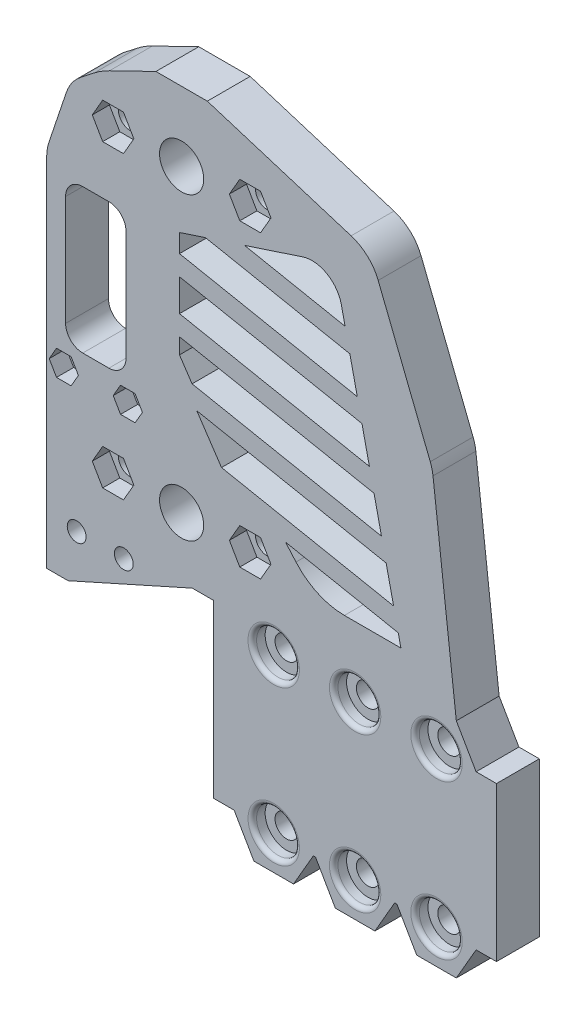
from build123d import *

# Parameters (mm, degrees)
SKETCH_1_W                 = 211.039105054
SKETCH_1_H                 = 148.201618718
EXTRUDE_1_DEPTH            = 10
CUT_EXTRUDE_1_DEPTH        = 130.326354287
CUT_EXTRUDE_2_DEPTH        = 130.326354287
SKETCH_6_R                 = 2.5
CUT_EXTRUDE_3_DEPTH        = 130.326354287
SKETCH_7_R                 = 2.5
CUT_EXTRUDE_4_DEPTH        = 130.326354287
SKETCH_8_R                 = 2.75
CUT_EXTRUDE_5_DEPTH        = 130.326354287
SKETCH_9_R                 = 2.75
CUT_EXTRUDE_6_DEPTH        = 130.326354287
SKETCH_10_R                = 2.75
CUT_EXTRUDE_7_DEPTH        = 130.326354287
SKETCH_11_R                = 2.75
EXTRUDE_3_DEPTH            = 10
SKETCH_12_W                = 106.039105054
SKETCH_12_H                = 148.201618718
CUT_EXTRUDE_8_DEPTH        = 130.326354287
CUT_EXTRUDE_9_DEPTH        = 130.326354287
CUT_EXTRUDE_11_DEPTH       = 130.326354287
CUT_EXTRUDE_12_DEPTH       = 10
CUT_EXTRUDE_13_DEPTH       = 10
FILLET_1_R                 = 10
FILLET_2_R                 = 10
FILLET_3_R                 = 10
FILLET_4_R                 = 10
SKETCH_19_W                = 14.096766614
SKETCH_19_H                = 41.379173134
CUT_EXTRUDE_15_DEPTH       = 130.326354287
FILLET_6_R                 = 4
EXTRUDE_4_DEPTH            = 10
FILLET_7_R                 = 4
SKETCH_21_R                = 2
CUT_EXTRUDE_16_DEPTH       = 2
FILLET_8_R                 = 1
SKETCH_22_R                = 1.5
CUT_EXTRUDE_17_DEPTH       = 130.326354287
CUT_EXTRUDE_18_DEPTH       = 130.326354287
EXTRUDE_5_DEPTH            = 10
CUT_EXTRUDE_19_DEPTH       = 130.326354287
FILLET_9_R                 = 15
CHAMFER_2_SIZE             = 10
CHAMFER_2_SIZE_2           = 12.687576361
CHAMFER_3_SIZE             = 3
CHAMFER_3_SIZE2            = 3.806272908
CUT_EXTRUDE_20_DEPTH       = 4
EXTRUDE_6_DEPTH            = 10
FILLET_10_DEPTH            = 10
FILLET_11_DEPTH            = 10
SKETCH_28_R                = 4.5
CUT_EXTRUDE_21_DEPTH       = 3
FILLET_12_R                = 1
SKETCH_29_R                = 2
CUT_EXTRUDE_22_DEPTH       = 130.326354287
CUT_EXTRUDE_23_DEPTH       = 3.3
SKETCH_31_R                = 5.15
SKETCH_31_R_2              = 2.7
SKETCH_31_R_3              = 2.2
SKETCH_31_R_4              = 1.7
CUT_EXTRUDE_24_DEPTH       = 130.326354287
SKETCH_32_R                = 2.5
CUT_EXTRUDE_25_DEPTH       = 2
FILLET_13_R                = 1
CUT_EXTRUDE_26_DEPTH       = 3.3
CUT_EXTRUDE_27_DEPTH       = 4
CUT_EXTRUDE_START          = -3
CUT_EXTRUDE_28_OUTLINE_R   = 5
CUT_EXTRUDE_28_OUTLINE_R_2 = 2.7
CUT_EXTRUDE_28_DEPTH       = 3
FILLET_14_R                = 1
FILLET_15_R                = 1
FILLET_16_R                = 1
FILLET_17_R                = 1
FILLET_18_R                = 1
FILLET_19_R                = 1


with BuildPart() as part:
    # Эскиз1 → Бобышка-Вытянуть1 (new body)
    with BuildSketch(Plane.XY):
        Rectangle(SKETCH_1_W, SKETCH_1_H)
    extrude(amount=EXTRUDE_1_DEPTH)

    # Эскиз2 → Вырез-Вытянуть1 (cut, through all)
    with BuildSketch(Plane.XY.offset(10)):
        Polygon((39.519552527, -74.100809359), (48.899552527, -74.100809359), (44.279552527, -66.100809359), (39.519552527, -66.100809359), align=None)
        Polygon((58.139552527, -74.100809359), (67.899552527, -74.100809359), (63.279552527, -66.100809359), (62.759552527, -66.100809359), align=None)
        Polygon((77.139552527, -74.100809359), (86.899552527, -74.100809359), (82.279552527, -66.100809359), (81.759552527, -66.100809359), align=None)
        Polygon((96.139552527, -74.100809359), (105.519552527, -74.100809359), (105.519552527, -66.100809359), (100.759552527, -66.100809359), align=None)
    extrude(amount=-CUT_EXTRUDE_1_DEPTH, mode=Mode.SUBTRACT)

    # Эскиз3 → Вырез-Вытянуть2 (cut, through all)
    with BuildSketch(Plane.XY.offset(10)):
        Polygon((100.759552527, -30.100809359), (105.519552527, -30.100809359), (105.519552527, 74.100809359), (96.139552527, 74.100809359), (96.139552527, -22.100809359), align=None)
    extrude(amount=-CUT_EXTRUDE_2_DEPTH, mode=Mode.SUBTRACT)

    # Эскиз6 → Вырез-Вытянуть3 (cut, through all)
    with BuildSketch(Plane.XY.offset(10)):
        with Locations((72.519552527, -66.100809359)):
            Circle(SKETCH_6_R)
        with Locations((53.519552527, -66.100809359)):
            Circle(SKETCH_6_R)
        with Locations((91.519552527, -66.100809359)):
            Circle(SKETCH_6_R)
    extrude(amount=-CUT_EXTRUDE_3_DEPTH, mode=Mode.SUBTRACT)

    # Эскиз7 → Вырез-Вытянуть4 (cut, through all)
    with BuildSketch(Plane.XY.offset(10)):
        with Locations((53.519552527, -66.100809359)):
            Circle(SKETCH_7_R)
        with Locations((72.519552527, -66.100809359)):
            Circle(SKETCH_7_R)
        with Locations((91.519552527, -66.100809359)):
            Circle(SKETCH_7_R)
        with Locations(Location((91.519552527, -30.100809359, 0), (0, 0, 180))):
            Circle(SKETCH_7_R)
        with Locations(Location((72.519552527, -30.100809359, 0), (0, 0, 180))):
            Circle(SKETCH_7_R)
        with Locations(Location((53.519552527, -30.100809359, 0), (0, 0, 180))):
            Circle(SKETCH_7_R)
    extrude(amount=-CUT_EXTRUDE_4_DEPTH, mode=Mode.SUBTRACT)

    # Эскиз8 → Вырез-Вытянуть5 (cut, through all)
    with BuildSketch(Plane(origin=(0, 0, 0), x_dir=(-1, 0, 0), z_dir=(0, 0, -1))):
        with Locations((-48.019552527, -12.100809359)):
            Circle(SKETCH_8_R)
        with Locations((-16.019552527, -12.100809359)):
            Circle(SKETCH_8_R)
    extrude(amount=-CUT_EXTRUDE_5_DEPTH, mode=Mode.SUBTRACT)

    # Эскиз9 → Вырез-Вытянуть6 (cut, through all)
    with BuildSketch(Plane(origin=(0, 0, 0), x_dir=(-1, 0, 0), z_dir=(0, 0, -1))):
        with Locations((-48.019552527, 63.899190641)):
            Circle(SKETCH_9_R)
        with Locations((-16.019552527, 63.899190641)):
            Circle(SKETCH_9_R)
    extrude(amount=-CUT_EXTRUDE_6_DEPTH, mode=Mode.SUBTRACT)

    # Эскиз10 → Вырез-Вытянуть7 (cut, through all)
    with BuildSketch(Plane(origin=(0, 0, 0), x_dir=(-1, 0, 0), z_dir=(0, 0, -1))):
        with Locations((-48.019552527, 57.899190641)):
            Circle(SKETCH_10_R)
        with Locations((-16.019552527, 57.899190641)):
            Circle(SKETCH_10_R)
    extrude(amount=-CUT_EXTRUDE_7_DEPTH, mode=Mode.SUBTRACT)

    # Эскиз11 → Бобышка-Вытянуть3 (add)
    with BuildSketch(Plane(origin=(0, 0, 0), x_dir=(-1, 0, 0), z_dir=(0, 0, -1))):
        with Locations((-48.019552527, 63.899190641)):
            Circle(SKETCH_11_R)
        with Locations((-16.019552527, 63.899190641)):
            Circle(SKETCH_11_R)
    extrude(amount=-EXTRUDE_3_DEPTH)

    # Эскиз12 → Вырез-Вытянуть8 (cut, through all)
    with BuildSketch(Plane(origin=(0, 0, 0), x_dir=(-1, 0, 0), z_dir=(0, 0, -1))):
        with Locations((52.5, 0)):
            Rectangle(SKETCH_12_W, SKETCH_12_H)
    extrude(amount=-CUT_EXTRUDE_8_DEPTH, mode=Mode.SUBTRACT)

    # Эскиз13 → Вырез-Вытянуть9 (cut, through all)
    with BuildSketch(Plane(origin=(0, 0, 0), x_dir=(-1, 0, 0), z_dir=(0, 0, -1))):
        Polygon((-39.519552527, -26.100809359), (-39.519552527, -30.100809359), (-39.519552527, -39.100809359), (-39.519552527, -66.100809359), (-39.519552527, -74.100809359), (-0.519552527, -74.100809359), (-0.519552527, -39.100809359), (-5.519552527, -39.100809359), (-34.519552527, -26.100809359), align=None)
    extrude(amount=-CUT_EXTRUDE_9_DEPTH, mode=Mode.SUBTRACT)

    # Эскиз14 → Вырез-Вытянуть11 (cut, through all)
    with BuildSketch(Plane(origin=(0, 0, 0), x_dir=(-1, 0, 0), z_dir=(0, 0, -1))):
        with BuildLine():
            Line((-26.019552527, 74.100809359), (-0.519552527, 74.100809359))
            Line((-0.519552527, 74.100809359), (-0.519552527, 57.899190641))
            Line((-0.519552527, 57.899190641), (-0.519552527, 45.742327896))
            Line((-0.519552527, 45.742327896), (-6.055786387, 62.241334845))
            Line((-6.055786387, 62.241334845), (-11.592020247, 66.583479049))
            ThreePointArc((-11.592020247, 66.583479049), (-13.329635828, 67.80312297), (-15.186741047, 68.831713952))
            Line((-15.186741047, 68.831713952), (-26.019552527, 74.100809359))
        make_face()
    extrude(amount=-CUT_EXTRUDE_11_DEPTH, mode=Mode.SUBTRACT)

    # Эскиз17 → Вырез-Вытянуть12 (cut)
    with BuildSketch(Plane(origin=(0, 0, 0), x_dir=(-1, 0, 0), z_dir=(0, 0, -1))):
        Polygon((-38.019552527, 74.100809359), (-76.139552527, 62.241334845), (-90.54927331, 26), (-96.139552527, -22.100809359), (-96.139552527, 74.100809359), align=None)
    extrude(amount=-CUT_EXTRUDE_12_DEPTH, mode=Mode.SUBTRACT)

    # Эскиз18 → Вырез-Вытянуть13 (cut)
    with BuildSketch(Plane(origin=(0, 0, 0), x_dir=(-1, 0, 0), z_dir=(0, 0, -1))):
        with BuildLine():
            ThreePointArc((-27.019552527, 57.899190641), (-32.019552527, 62.899190641), (-37.019552527, 57.899190641))
            Line((-37.019552527, 57.899190641), (-27.019552527, 57.899190641))
        make_face()
        with BuildLine():
            Line((-27.019552527, 57.899190641), (-37.019552527, 57.899190641))
            ThreePointArc((-37.019552527, 57.899190641), (-32.019552527, 52.899190641), (-27.019552527, 57.899190641))
        make_face()
        with BuildLine():
            ThreePointArc((-27.019552527, -12.100809359), (-32.019552527, -7.100809359), (-37.019552527, -12.100809359))
            Line((-37.019552527, -12.100809359), (-27.019552527, -12.100809359))
        make_face()
        with BuildLine():
            Line((-27.019552527, -12.100809359), (-37.019552527, -12.100809359))
            ThreePointArc((-37.019552527, -12.100809359), (-32.019552527, -17.100809359), (-27.019552527, -12.100809359))
        make_face()
    extrude(amount=-CUT_EXTRUDE_13_DEPTH, mode=Mode.SUBTRACT)

    # Скругление1
    fillet_1_edges = [part.edges().sort_by_distance(p)[0] for p in [
        (76.139552527, 62.241334845, 5),
    ]]
    fillet(fillet_1_edges, radius=FILLET_1_R)

    # Скругление2
    fillet_2_edges = [part.edges().sort_by_distance(p)[0] for p in [
        (90.54927331, 26, 5),
    ]]
    fillet(fillet_2_edges, radius=FILLET_2_R)

    # Скругление3
    fillet_3_edges = [part.edges().sort_by_distance(p)[0] for p in [
        (6.055786387, 62.241334845, 5),
    ]]
    fillet(fillet_3_edges, radius=FILLET_3_R)

    # Скругление4
    fillet_4_edges = [part.edges().sort_by_distance(p)[0] for p in [
        (0.519552527, 45.742327896, 5),
    ]]
    fillet(fillet_4_edges, radius=FILLET_4_R)

    # Эскиз19 → Вырез-Вытянуть15 (cut, through all)
    with BuildSketch(Plane(origin=(0, 0, 0), x_dir=(-1, 0, 0), z_dir=(0, 0, -1))):
        with Locations((-11.990658259, 26.60091532)):
            Rectangle(SKETCH_19_W, SKETCH_19_H)
    extrude(amount=-CUT_EXTRUDE_15_DEPTH, mode=Mode.SUBTRACT)

    # Скругление6
    fillet_6_edges = [part.edges().sort_by_distance(p)[0] for p in [
        (4.942274952, 5.911328753, 5),
        (19.039041566, 5.911328753, 5),
        (19.039041566, 47.290501887, 5),
        (4.942274952, 47.290501887, 5),
    ]]
    fillet(fillet_6_edges, radius=FILLET_6_R)

    # Эскиз20 → Бобышка-Вытянуть4 (add)
    with BuildSketch(Plane(origin=(0, 0, 0), x_dir=(-1, 0, 0), z_dir=(0, 0, -1))):
        Polygon((-19.039041566, 47.290501887), (-19.039041566, 43.290501887), (-19.039041566, 42.290501887), (-4.942274952, 42.290501887), (-4.942274952, 47.290501887), align=None)
    extrude(amount=-EXTRUDE_4_DEPTH)

    # Скругление7
    fillet_7_edges = [part.edges().sort_by_distance(p)[0] for p in [
        (19.039041566, 42.290501887, 5),
        (4.942274952, 42.290501887, 5),
    ]]
    fillet(fillet_7_edges, radius=FILLET_7_R)

    # Эскиз21 → Вырез-Вытянуть16 (cut)
    with BuildSketch(Plane(origin=(0, 0, 0), x_dir=(-1, 0, 0), z_dir=(0, 0, -1))):
        with Locations((-11.990658259, 46.790501887)):
            Circle(SKETCH_21_R)
    extrude(amount=-CUT_EXTRUDE_16_DEPTH, mode=Mode.SUBTRACT)

    # Скругление8
    fillet_8_edges = [part.edges().sort_by_distance(p)[0] for p in [
        (13.990658259, 46.790501887, 0),
    ]]
    fillet(fillet_8_edges, radius=FILLET_8_R)

    # Эскиз22 → Вырез-Вытянуть17 (cut, through all)
    with BuildSketch(Plane(origin=(0, 0, 0), x_dir=(-1, 0, 0), z_dir=(0, 0, -1))):
        with Locations((-4.519552527, 3.601328753)):
            Circle(SKETCH_22_R)
        with Locations((-19.459552527, 3.601328753)):
            Circle(SKETCH_22_R)
    extrude(amount=-CUT_EXTRUDE_17_DEPTH, mode=Mode.SUBTRACT)

    # Эскиз23 → Вырез-Вытянуть18 (cut, through all)
    with BuildSketch(Plane(origin=(0, 0, 0), x_dir=(-1, 0, 0), z_dir=(0, 0, -1))):
        with BuildLine():
            Line((-83.202253585, -13.858982793), (-69.299601314, 48.615184052))
            ThreePointArc((-69.299601314, 48.615184052), (-65.927986564, 53.179027934), (-60.282091208, 53.744998448))
            Line((-60.282091208, 53.744998448), (-31.519552527, 44.296464045))
            Line((-31.519552527, 44.296464045), (-31.519552527, 4.027188786))
            Line((-31.519552527, 4.027188786), (-33.250013878, 4.027188786))
            Line((-33.250013878, 4.027188786), (-50.568370486, 0.620298961))
            Line((-50.568370486, 0.620298961), (-63.202253585, -13.858982793))
            Line((-63.202253585, -13.858982793), (-83.202253585, -13.858982793))
        make_face()
    extrude(amount=-CUT_EXTRUDE_18_DEPTH, mode=Mode.SUBTRACT)

    # Эскиз24 → Бобышка-Вытянуть5 (add)
    with BuildSketch(Plane(origin=(0, 0, 0), x_dir=(-1, 0, 0), z_dir=(0, 0, -1))):
        Polygon((-46.699474212, 49.283089665), (-70.178831302, 44.664199746), (-71.291503385, 39.664199746), (-37.596452717, 46.292734303), align=None)
        Polygon((-31.519552527, 40.021065968), (-73.029270164, 31.855219875), (-74.115374402, 26.974607456), (-31.519552527, 35.354113399), align=None)
        Polygon((-31.519552527, 27.886989288), (-75.853141181, 19.165627585), (-76.939245419, 14.285015166), (-31.519552527, 23.220036719), align=None)
        Polygon((-31.519552527, 15.752912608), (-78.677012198, 6.476035296), (-79.763116436, 1.595422877), (-31.519552527, 11.085960039), align=None)
        Polygon((-51.357093882, -0.283631223), (-81.500883215, -6.213556994), (-82.586987453, -11.094169413), (-56.273059249, -5.917658947), align=None)
    extrude(amount=-EXTRUDE_5_DEPTH)

    # Эскиз25 → Вырез-Вытянуть19 (cut, through all)
    with BuildSketch(Plane(origin=(0, 0, 0), x_dir=(-1, 0, 0), z_dir=(0, 0, -1))):
        Polygon((-52.445727222, 6.969335509), (-51.357093882, -0.283631223), (-31.519552527, 3.618835928), (-31.519552527, 4.027188786), (-31.519552527, 11.085960039), align=None)
    extrude(amount=-CUT_EXTRUDE_19_DEPTH, mode=Mode.SUBTRACT)

    # Скругление9
    fillet_9_edges = [part.edges().sort_by_distance(p)[0] for p in [
        (63.202253585, -13.858982793, 5),
    ]]
    fillet(fillet_9_edges, radius=FILLET_9_R)

    # Фаска2
    # the kernel refuses this chamfer: 12.687576361, 10 mm, written as the material it adds along each edge
    with BuildSketch(Plane(origin=(31.519552527, 3.618835928, 0), x_dir=(0.9811944564911176, -0.19302186029333682, 0), z_dir=(0, 0, 1))) as chamfer_2_piece_1_section:
        Polygon((CHAMFER_2_SIZE, 0), (-CHAMFER_2_SIZE_2 * 0.193021860295, CHAMFER_2_SIZE_2 * 0.9811944565), (0, 0), align=None)
    chamfer_2_piece_1 = extrude(amount=10, mode=Mode.PRIVATE)
    chamfer_2_piece_1 = split(chamfer_2_piece_1, bisect_by=Plane(origin=(33.817649326, 15.300827992, 0), z_dir=(-0.19302186029333676, -0.9811944564911176, 0)), keep=Keep.TOP, mode=Mode.PRIVATE)
    add(chamfer_2_piece_1)

    # Фаска3
    chamfer_3_edges = [part.edges().sort_by_distance(p)[0] for p in [
        (31.519552527, 15.752912608, 5),
    ]]
    chamfer_3_side = [part.faces().sort_by_distance(p)[0] for p in [
        (55.098282363, 11.114473952, 5),
    ]]
    chamfer(chamfer_3_edges, length=CHAMFER_3_SIZE, length2=CHAMFER_3_SIZE2, reference=chamfer_3_side[0])

    # Эскиз26 → Вырез-Вытянуть20 (cut)
    with BuildSketch(Plane.XY.offset(10)):
        Polygon((18.328953604, 53.899190641), (20.63835468, 57.899190641), (18.328953604, 61.899190641), (13.71015145, 61.899190641), (11.400750373, 57.899190641), (13.71015145, 53.899190641), align=None)
        Polygon((43.400750373, 57.899190641), (45.71015145, 53.899190641), (50.328953604, 53.899190641), (52.63835468, 57.899190641), (50.328953604, 61.899190641), (45.71015145, 61.899190641), align=None)
        Polygon((20.63835468, -12.100809359), (18.328953604, -8.100809359), (13.71015145, -8.100809359), (11.400750373, -12.100809359), (13.71015145, -16.100809359), (18.328953604, -16.100809359), align=None)
        Polygon((52.63835468, -12.100809359), (50.328953604, -8.100809359), (45.71015145, -8.100809359), (43.400750373, -12.100809359), (45.71015145, -16.100809359), (50.328953604, -16.100809359), align=None)
        Polygon((6.107265767, 0.851328753), (7.694979007, 3.601328753), (6.107265767, 6.351328753), (2.931839287, 6.351328753), (1.344126046, 3.601328753), (2.931839287, 0.851328753), align=None)
        Polygon((21.047265767, 0.851328753), (22.634979007, 3.601328753), (21.047265767, 6.351328753), (17.871839287, 6.351328753), (16.284126046, 3.601328753), (17.871839287, 0.851328753), align=None)
    extrude(amount=-CUT_EXTRUDE_20_DEPTH, mode=Mode.SUBTRACT)

    # Эскиз27 → Бобышка-Вытянуть6 (add)
    with BuildSketch(Plane.XY.offset(10)):
        Polygon((18.83108489, 8.638376504), (5.150231629, 8.638376504), (5.777883842, 6.768640711), (8.050442888, 5.638376504), (15.868553058, 5.638376504), (18.83108489, 7.138376504), align=None)
    extrude(amount=-EXTRUDE_6_DEPTH)

    # Скругление10: read off the stored shape, not the designer's step
    # Скругление10 outline → Скругление10 (add)
    with BuildSketch(Plane.XY):
        with BuildLine():
            ThreePointArc((8.942274952, 8.638376504), (6.113847827, 9.80994938), (4.942274952, 12.638376504))
            Line((4.942274952, 12.638376504), (4.942274952, 9.911328753))
            ThreePointArc((4.942274952, 9.911328753), (4.994606445, 9.266415308), (5.150231629, 8.638376504))
            Line((5.150231629, 8.638376504), (8.942274952, 8.638376504))
        make_face()
    extrude(amount=FILLET_10_DEPTH)

    # Скругление11: read off the stored shape, not the designer's step
    # Скругление11 outline → Скругление11 (add)
    with BuildSketch(Plane.XY):
        with BuildLine():
            Line((19.039041566, 9.911328753), (19.039041566, 12.638376504))
            ThreePointArc((19.039041566, 12.638376504), (17.867468691, 9.809949379), (15.039041566, 8.638376504))
            Line((15.039041566, 8.638376504), (18.83108489, 8.638376504))
            ThreePointArc((18.83108489, 8.638376504), (18.986710074, 9.266415308), (19.039041566, 9.911328753))
        make_face()
    extrude(amount=FILLET_11_DEPTH)

    # Эскиз28 → Вырез-Вытянуть21 (cut)
    with BuildSketch(Plane.XY.offset(10)):
        with Locations((53.519552527, -30.100809359)):
            Circle(SKETCH_28_R)
        with Locations((72.519552527, -30.100809359)):
            Circle(SKETCH_28_R)
        with Locations((91.519552527, -30.100809359)):
            Circle(SKETCH_28_R)
        with Locations((91.519552527, -66.100809359)):
            Circle(SKETCH_28_R)
        with Locations((72.519552527, -66.100809359)):
            Circle(SKETCH_28_R)
        with Locations((53.519552527, -66.100809359)):
            Circle(SKETCH_28_R)
    extrude(amount=-CUT_EXTRUDE_21_DEPTH, mode=Mode.SUBTRACT)

    # Скругление12
    fillet_12_edges = [part.edges().sort_by_distance(p)[0] for p in [
        (49.019552527, -30.100809359, 10),
        (68.019552527, -30.100809359, 10),
        (87.019552527, -30.100809359, 10),
        (87.019552527, -66.100809359, 10),
        (68.019552527, -66.100809359, 10),
        (49.019552527, -66.100809359, 10),
    ]]
    fillet(fillet_12_edges, radius=FILLET_12_R)

    # Эскиз29 → Вырез-Вытянуть22 (cut, through all)
    with BuildSketch(Plane(origin=(0, 0, 0), x_dir=(-1, 0, 0), z_dir=(0, 0, -1))):
        with Locations((-7.519552527, -28.170809359)):
            Circle(SKETCH_29_R)
        with Locations((-18.519552527, -28.170809359)):
            Circle(SKETCH_29_R)
    extrude(amount=-CUT_EXTRUDE_22_DEPTH, mode=Mode.SUBTRACT)

    # Эскиз30 → Вырез-Вытянуть23 (cut)
    with BuildSketch(Plane(origin=(0, 0, 0), x_dir=(-1, 0, 0), z_dir=(0, 0, -1))):
        Polygon((-7.519552527, -32.212261243), (-4.019552527, -30.191535301), (-4.019552527, -26.150083417), (-7.519552527, -24.129357474), (-11.019552527, -26.150083417), (-11.019552527, -30.191535301), align=None)
        Polygon((-18.519552527, -32.212261243), (-15.019552527, -30.191535301), (-15.019552527, -26.150083417), (-18.519552527, -24.129357474), (-22.019552527, -26.150083417), (-22.019552527, -30.191535301), align=None)
    extrude(amount=-CUT_EXTRUDE_23_DEPTH, mode=Mode.SUBTRACT)

    # Эскиз31 → Вырез-Вытянуть24 (cut, through all)
    with BuildSketch(Plane(origin=(0, 0, 0), x_dir=(-1, 0, 0), z_dir=(0, 0, -1))):
        with Locations((-32.019552527, 57.899190641)):
            Circle(SKETCH_31_R)
        with Locations((-16.019552527, 57.899190641)):
            Circle(SKETCH_31_R_2)
        with Locations((-48.019552527, 57.899190641)):
            Circle(SKETCH_31_R_2)
        with Locations((-32.019552527, -12.100809359)):
            Circle(SKETCH_31_R)
        with Locations((-16.019552527, -12.100809359)):
            Circle(SKETCH_31_R_2)
        with Locations((-48.019552527, -12.100809359)):
            Circle(SKETCH_31_R_2)
        with Locations((-53.519552527, -30.100809359)):
            Circle(SKETCH_31_R_2)
        with Locations((-72.519552527, -30.100809359)):
            Circle(SKETCH_31_R_2)
        with Locations((-91.519552527, -30.100809359)):
            Circle(SKETCH_31_R_2)
        with Locations((-91.519552527, -66.100809359)):
            Circle(SKETCH_31_R_2)
        with Locations((-72.519552527, -66.100809359)):
            Circle(SKETCH_31_R_2)
        with Locations((-53.519552527, -66.100809359)):
            Circle(SKETCH_31_R_2)
        with Locations((-18.519552527, -28.170809359)):
            Circle(SKETCH_31_R_3)
        with Locations((-7.519552527, -28.170809359)):
            Circle(SKETCH_31_R_3)
        with Locations((-4.519552527, 3.601328753)):
            Circle(SKETCH_31_R_4)
        with Locations((-19.459552527, 3.601328753)):
            Circle(SKETCH_31_R_4)
    extrude(amount=-CUT_EXTRUDE_24_DEPTH, mode=Mode.SUBTRACT)

    # Эскиз32 → Вырез-Вытянуть25 (cut)
    with BuildSketch(Plane(origin=(0, 0, 0), x_dir=(-1, 0, 0), z_dir=(0, 0, -1))):
        with Locations((-11.990658259, 46.790501887)):
            Circle(SKETCH_32_R)
    extrude(amount=-CUT_EXTRUDE_25_DEPTH, mode=Mode.SUBTRACT)

    # Скругление13
    fillet_13_edges = [part.edges().sort_by_distance(p)[0] for p in [
        (14.990658259, 46.790501887, 0),
        (14.490658259, 46.790501887, 0.133974596),
    ]]
    fillet(fillet_13_edges, radius=FILLET_13_R - 0.0001)  # a hair under: the kernel refuses the full size

    # Эскиз33 → Вырез-Вытянуть26 (cut)
    with BuildSketch(Plane(origin=(0, 0, 0), x_dir=(-1, 0, 0), z_dir=(0, 0, -1))):
        Polygon((-18.519552527, -32.443201351), (-14.819552527, -30.307005355), (-14.819552527, -26.034613363), (-18.519552527, -23.898417367), (-22.219552527, -26.034613363), (-22.219552527, -30.307005355), align=None)
        Polygon((-7.519552527, -32.443201351), (-3.819552527, -30.307005355), (-3.819552527, -26.034613363), (-7.519552527, -23.898417367), (-11.219552527, -26.034613363), (-11.219552527, -30.307005355), align=None)
    extrude(amount=-CUT_EXTRUDE_26_DEPTH, mode=Mode.SUBTRACT)

    # Эскиз34 → Вырез-Вытянуть27 (cut)
    with BuildSketch(Plane.XY.offset(10)):
        Polygon((50.444423658, 53.699190641), (52.869294788, 57.899190641), (50.444423658, 62.099190641), (45.594681396, 62.099190641), (43.169810266, 57.899190641), (45.594681396, 53.699190641), align=None)
        Polygon((18.444423658, 53.699190641), (20.869294788, 57.899190641), (18.444423658, 62.099190641), (13.594681396, 62.099190641), (11.169810266, 57.899190641), (13.594681396, 53.699190641), align=None)
        Polygon((17.756369233, 0.651328753), (21.162735821, 0.651328753), (22.865919115, 3.601328753), (21.162735821, 6.551328753), (17.756369233, 6.551328753), (16.053185939, 3.601328753), align=None)
        Polygon((2.816369233, 0.651328753), (6.222735821, 0.651328753), (7.925919115, 3.601328753), (6.222735821, 6.551328753), (2.816369233, 6.551328753), (1.113185939, 3.601328753), align=None)
        Polygon((13.594681396, -16.300809359), (18.444423658, -16.300809359), (20.869294788, -12.100809359), (18.444423658, -7.900809359), (13.594681396, -7.900809359), (11.169810266, -12.100809359), align=None)
        Polygon((45.594681396, -16.300809359), (50.444423658, -16.300809359), (52.869294788, -12.100809359), (50.444423658, -7.900809359), (45.594681396, -7.900809359), (43.169810266, -12.100809359), align=None)
    extrude(amount=-CUT_EXTRUDE_27_DEPTH, mode=Mode.SUBTRACT)

    # Вырез-Вытянуть28: read off the stored shape, not the designer's step
    # Вырез-Вытянуть28 outline → Вырез-Вытянуть28 (cut)
    # profile 1 of 6: a face of its own
    with BuildSketch(Plane.XY.offset(10).offset(CUT_EXTRUDE_START)):
        with Locations((53.519552527, -30.100809359)):
            Circle(CUT_EXTRUDE_28_OUTLINE_R)
        with Locations((53.519552527, -30.100809359)):
            Circle(CUT_EXTRUDE_28_OUTLINE_R_2, mode=Mode.SUBTRACT)
    # profile 2 of 6: a face of its own
    with BuildSketch(Plane.XY.offset(10).offset(CUT_EXTRUDE_START)):
        with Locations((72.519552527, -30.100809359)):
            Circle(CUT_EXTRUDE_28_OUTLINE_R)
        with Locations((72.519552527, -30.100809359)):
            Circle(CUT_EXTRUDE_28_OUTLINE_R_2, mode=Mode.SUBTRACT)
    # profile 3 of 6: a face of its own
    with BuildSketch(Plane.XY.offset(10).offset(CUT_EXTRUDE_START)):
        with Locations((91.519552527, -30.100809359)):
            Circle(CUT_EXTRUDE_28_OUTLINE_R)
        with Locations((91.519552527, -30.100809359)):
            Circle(CUT_EXTRUDE_28_OUTLINE_R_2, mode=Mode.SUBTRACT)
    # profile 4 of 6: a face of its own
    with BuildSketch(Plane.XY.offset(10).offset(CUT_EXTRUDE_START)):
        with Locations((91.519552527, -66.100809359)):
            Circle(CUT_EXTRUDE_28_OUTLINE_R)
        with Locations((91.519552527, -66.100809359)):
            Circle(CUT_EXTRUDE_28_OUTLINE_R_2, mode=Mode.SUBTRACT)
    # profile 5 of 6: a face of its own
    with BuildSketch(Plane.XY.offset(10).offset(CUT_EXTRUDE_START)):
        with Locations((72.519552527, -66.100809359)):
            Circle(CUT_EXTRUDE_28_OUTLINE_R)
        with Locations((72.519552527, -66.100809359)):
            Circle(CUT_EXTRUDE_28_OUTLINE_R_2, mode=Mode.SUBTRACT)
    # profile 6 of 6: a face of its own
    with BuildSketch(Plane.XY.offset(10).offset(CUT_EXTRUDE_START)):
        with Locations((53.519552527, -66.100809359)):
            Circle(CUT_EXTRUDE_28_OUTLINE_R)
        with Locations((53.519552527, -66.100809359)):
            Circle(CUT_EXTRUDE_28_OUTLINE_R_2, mode=Mode.SUBTRACT)
    extrude(amount=CUT_EXTRUDE_28_DEPTH, mode=Mode.SUBTRACT)

    # Скругление14
    fillet_14_edges = [part.edges().sort_by_distance(p)[0] for p in [
        (48.519552528, -30.100809359, 9.866025404),
        (48.019552527, -30.100809359, 10),
    ]]
    fillet(fillet_14_edges, radius=FILLET_14_R - 0.0001)  # a hair under: the kernel refuses the full size

    # Скругление15
    fillet_15_edges = [part.edges().sort_by_distance(p)[0] for p in [
        (67.519552528, -66.100809359, 9.866025404),
        (67.019552527, -66.100809359, 10),
    ]]
    fillet(fillet_15_edges, radius=FILLET_15_R - 0.0001)  # a hair under: the kernel refuses the full size

    # Скругление16
    fillet_16_edges = [part.edges().sort_by_distance(p)[0] for p in [
        (67.519552528, -30.100809359, 9.866025404),
        (67.019552527, -30.100809359, 10),
    ]]
    fillet(fillet_16_edges, radius=FILLET_16_R - 0.0001)  # a hair under: the kernel refuses the full size

    # Скругление17
    fillet_17_edges = [part.edges().sort_by_distance(p)[0] for p in [
        (86.519552528, -30.100809359, 9.866025404),
        (86.019552527, -30.100809359, 10),
    ]]
    fillet(fillet_17_edges, radius=FILLET_17_R - 0.0001)  # a hair under: the kernel refuses the full size

    # Скругление18
    fillet_18_edges = [part.edges().sort_by_distance(p)[0] for p in [
        (48.519552528, -66.100809359, 9.866025404),
        (48.019552527, -66.100809359, 10),
    ]]
    fillet(fillet_18_edges, radius=FILLET_18_R - 0.0001)  # a hair under: the kernel refuses the full size

    # Скругление19
    fillet_19_edges = [part.edges().sort_by_distance(p)[0] for p in [
        (86.519552528, -66.100809359, 9.866025404),
        (86.019552527, -66.100809359, 10),
    ]]
    fillet(fillet_19_edges, radius=FILLET_19_R - 0.0001)  # a hair under: the kernel refuses the full size


solid = part.part
